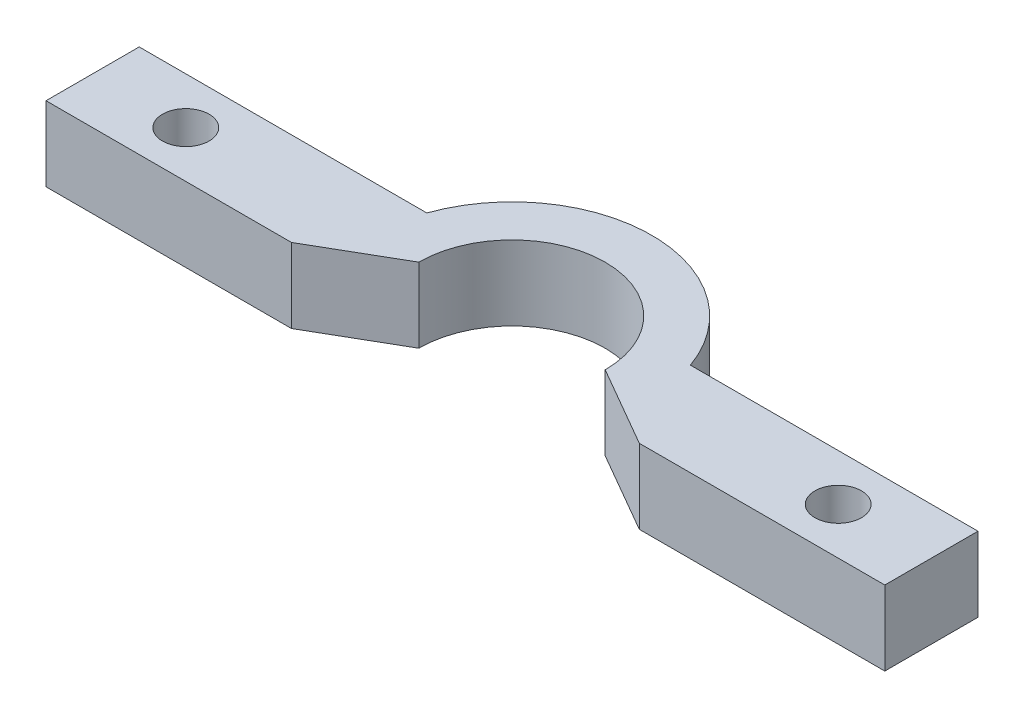
from build123d import *

# Parameters (mm, degrees)
SKETCH1_R           = 0.79375
BOSS_EXTRUDE1_DEPTH = 1.27


with BuildPart() as part:
    # Sketch1 → Boss-Extrude1 (new, symmetric)
    with BuildSketch(Plane(origin=(0, 0, 0), x_dir=(1, 0, 0), z_dir=(0, 1, 0))):
        with BuildLine():
            Line((3.175, 0), (5.924630657, -1.5875))
            Line((5.924630657, -1.5875), (14.2875, -1.5875))
            Line((14.2875, -1.5875), (14.2875, 1.5875))
            Line((14.2875, 1.5875), (4.490128061, 1.5875))
            ThreePointArc((4.490128061, 1.5875), (0, 4.7625), (-4.490128061, 1.5875))
            Line((-4.490128061, 1.5875), (-14.2875, 1.5875))
            Line((-14.2875, 1.5875), (-14.2875, -1.5875))
            Line((-14.2875, -1.5875), (-5.924630657, -1.5875))
            Line((-5.924630657, -1.5875), (-3.175, 0))
            ThreePointArc((-3.175, 0), (0, 3.175), (3.175, 0))
        make_face()
        with Locations((11.1125, 0)):
            Circle(SKETCH1_R, mode=Mode.SUBTRACT)
        with Locations((-11.1125, 0)):
            Circle(SKETCH1_R, mode=Mode.SUBTRACT)
    extrude(amount=BOSS_EXTRUDE1_DEPTH, both=True)


solid = part.part
